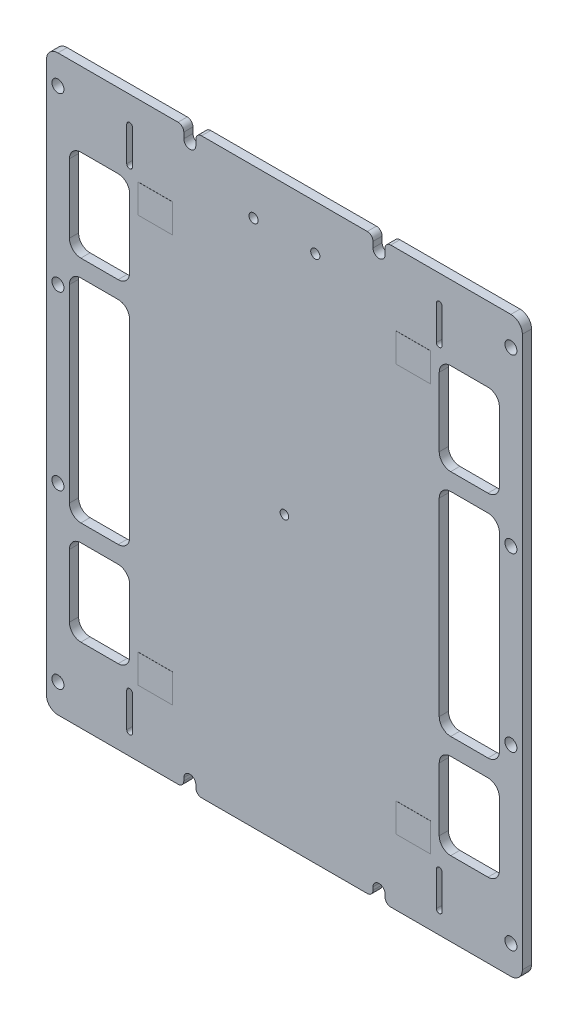
from build123d import *

# Parameters (mm, degrees)
BOARDOUTLINE_DEPTH          = 1.6
SKETCH2_R                   = 0.75
SKETCH2_R_2                 = 0.8
COMPONENTHOLES_DEPTH        = 65.998538445
SOLARCELLCONTACTHOLES_DEPTH = 1.6
WINDOWS_1SIDE_DEPTH         = 65.998538445
SKETCH5_W                   = 6
SKETCH5_H                   = 5
CONTACTPADS_DEPTH           = 0.02
M2_CLEARANCE_HOLE1_D        = 2.1
CUT_EXTRUDE1_DEPTH          = 65.999033839
FILLET3_R                   = 1
FILLET3_OF_MIRROR1_R        = 1


with BuildPart() as part:
    # Sketch1 → boardOutline (new body)
    with BuildSketch(Plane.XY):
        with BuildLine():
            Line((-39.5, -50), (39.5, -50))
            ThreePointArc((39.5, -50), (40.914213562, -49.414213562), (41.5, -48))
            Line((41.5, -48), (41.5, 48))
            ThreePointArc((41.5, 48), (40.914213562, 49.414213562), (39.5, 50))
            Line((39.5, 50), (-39.5, 50))
            ThreePointArc((-39.5, 50), (-40.914213562, 49.414213562), (-41.5, 48))
            Line((-41.5, 48), (-41.5, -48))
            ThreePointArc((-41.5, -48), (-40.914213562, -49.414213562), (-39.5, -50))
        make_face()
    extrude(amount=BOARDOUTLINE_DEPTH)

    # Sketch2 → componentHoles (cut, through all)
    with BuildSketch(Plane.XY.offset(1.6)):
        Circle(SKETCH2_R)
        with Locations((-5.385, 42.1)):
            Circle(SKETCH2_R_2)
        with Locations((5.385, 42.1)):
            Circle(SKETCH2_R_2)
    extrude(amount=-COMPONENTHOLES_DEPTH, mode=Mode.SUBTRACT)

    # Sketch4 → solarCellContactHoles (cut)
    with BuildSketch(Plane.XY.offset(1.6)):
        with BuildLine():
            Line((-27.5, 39.25), (-27.5, 45.25))
            ThreePointArc((-27.5, 45.25), (-27, 45.75), (-26.5, 45.25))
            Line((-26.5, 45.25), (-26.5, 39.25))
            ThreePointArc((-26.5, 39.25), (-27, 38.75), (-27.5, 39.25))
        make_face()
        with BuildLine():
            Line((26.5, 39.25), (26.5, 45.25))
            ThreePointArc((26.5, 45.25), (27, 45.75), (27.5, 45.25))
            Line((27.5, 45.25), (27.5, 39.25))
            ThreePointArc((27.5, 39.25), (27, 38.75), (26.5, 39.25))
        make_face()
        with BuildLine():
            Line((26.5, -46.25), (26.5, -40.25))
            ThreePointArc((26.5, -40.25), (27, -39.75), (27.5, -40.25))
            Line((27.5, -40.25), (27.5, -46.25))
            ThreePointArc((27.5, -46.25), (27, -46.75), (26.5, -46.25))
        make_face()
        with BuildLine():
            Line((-27.5, -46.25), (-27.5, -40.25))
            ThreePointArc((-27.5, -40.25), (-27, -39.75), (-26.5, -40.25))
            Line((-26.5, -40.25), (-26.5, -46.25))
            ThreePointArc((-26.5, -46.25), (-27, -46.75), (-27.5, -46.25))
        make_face()
    extrude(amount=-SOLARCELLCONTACTHOLES_DEPTH, mode=Mode.SUBTRACT)

    # Sketch3 → windows_1side (cut, through all)
    with BuildSketch(Plane.XY.offset(1.6)):
        with BuildLine():
            Line((-35.5, 37), (-29, 37))
            ThreePointArc((-29, 37), (-27.585786438, 36.414213562), (-27, 35))
            Line((-27, 35), (-27, 23))
            ThreePointArc((-27, 23), (-27.585786438, 21.585786438), (-29, 21))
            Line((-29, 21), (-35.5, 21))
            ThreePointArc((-35.5, 21), (-36.914213562, 21.585786438), (-37.5, 23))
            Line((-37.5, 23), (-37.5, 35))
            ThreePointArc((-37.5, 35), (-36.914213562, 36.414213562), (-35.5, 37))
        make_face()
        with BuildLine():
            Line((-29, -22), (-35.5, -22))
            ThreePointArc((-35.5, -22), (-36.914213562, -22.585786438), (-37.5, -24))
            Line((-37.5, -24), (-37.5, -35))
            ThreePointArc((-37.5, -35), (-36.914213562, -36.414213562), (-35.5, -37))
            Line((-35.5, -37), (-29, -37))
            ThreePointArc((-29, -37), (-27.585786438, -36.414213562), (-27, -35))
            Line((-27, -35), (-27, -24))
            ThreePointArc((-27, -24), (-27.585786438, -22.585786438), (-29, -22))
        make_face()
        with BuildLine():
            Line((-29, -19), (-35.5, -19))
            ThreePointArc((-35.5, -19), (-36.914213562, -18.414213562), (-37.5, -17))
            Line((-37.5, -17), (-37.5, 16))
            ThreePointArc((-37.5, 16), (-36.914213562, 17.414213562), (-35.5, 18))
            Line((-35.5, 18), (-29, 18))
            ThreePointArc((-29, 18), (-27.585786438, 17.414213562), (-27, 16))
            Line((-27, 16), (-27, -17))
            ThreePointArc((-27, -17), (-27.585786438, -18.414213562), (-29, -19))
        make_face()
    windows_1side = extrude(amount=-WINDOWS_1SIDE_DEPTH, mode=Mode.SUBTRACT)

    # Sketch5 → contactPads (add)
    with BuildSketch(Plane.XY.offset(1.6)):
        with Locations((-22.5, 35)):
            Rectangle(SKETCH5_W, SKETCH5_H)
        with Locations((22.5, 35)):
            Rectangle(SKETCH5_W, SKETCH5_H)
        with Locations((22.5, -36)):
            Rectangle(SKETCH5_W, SKETCH5_H)
        with Locations((-22.5, -36)):
            Rectangle(SKETCH5_W, SKETCH5_H)
    extrude(amount=CONTACTPADS_DEPTH)

    # M2 Clearance Hole1 (through all)
    with Locations(Plane(origin=(0, 0, 0), x_dir=(-1, 0, 0), z_dir=(0, 0, -1))):
        with Locations((39.5, 45), (39.5, -15), (39.5, -45), (39.5, 15)):
            m2_clearance_hole1 = Hole(M2_CLEARANCE_HOLE1_D / 2)

    # Sketch10 → Cut-Extrude1 (cut, symmetric)
    with BuildSketch(Plane(origin=(0, 0, 0), x_dir=(-1, 0, 0), z_dir=(0, 0, -1))):
        with BuildLine():
            Line((15.45, 48), (15.45, 55.073166109))
            ThreePointArc((15.45, 55.073166109), (16.5, 56.123166109), (17.55, 55.073166109))
            Line((17.55, 55.073166109), (17.55, 48))
            ThreePointArc((17.55, 48), (16.5, 46.95), (15.45, 48))
        make_face()
        with BuildLine():
            Line((17.55, -48.5), (17.55, -55.573166109))
            ThreePointArc((17.55, -55.573166109), (16.5, -56.623166109), (15.45, -55.573166109))
            Line((15.45, -55.573166109), (15.45, -48.5))
            ThreePointArc((15.45, -48.5), (16.5, -47.45), (17.55, -48.5))
        make_face()
    cut_extrude1 = extrude(amount=CUT_EXTRUDE1_DEPTH, both=True, mode=Mode.SUBTRACT)

    # Fillet3
    fillet3_edges = [part.edges().sort_by_distance(p)[0] for p in [
        (-17.55, 50, 0.8),
        (-15.45, 50, 0.8),
        (-15.45, -50, 0.8),
        (-17.55, -50, 0.8),
    ]]
    fillet(fillet3_edges, radius=FILLET3_R)

    # Mirror1: windows_1side, M2 Clearance Hole1, Cut-Extrude1 across plane
    add(windows_1side.mirror(Plane(origin=(0, 0, 0), x_dir=(0, 0, 1), z_dir=(1, 0, 0))), mode=Mode.SUBTRACT)
    add(m2_clearance_hole1.mirror(Plane(origin=(0, 0, 0), x_dir=(0, 0, 1), z_dir=(1, 0, 0))), mode=Mode.SUBTRACT)
    add(cut_extrude1.mirror(Plane(origin=(0, 0, 0), x_dir=(0, 0, 1), z_dir=(1, 0, 0))), mode=Mode.SUBTRACT)

    # Fillet3 of Mirror1
    fillet3_of_mirror1_edges = [part.edges().sort_by_distance(p)[0] for p in [
        (17.55, 50, 0.8),
        (15.45, 50, 0.8),
        (15.45, -50, 0.8),
        (17.55, -50, 0.8),
    ]]
    fillet(fillet3_of_mirror1_edges, radius=FILLET3_OF_MIRROR1_R)


solid = part.part
